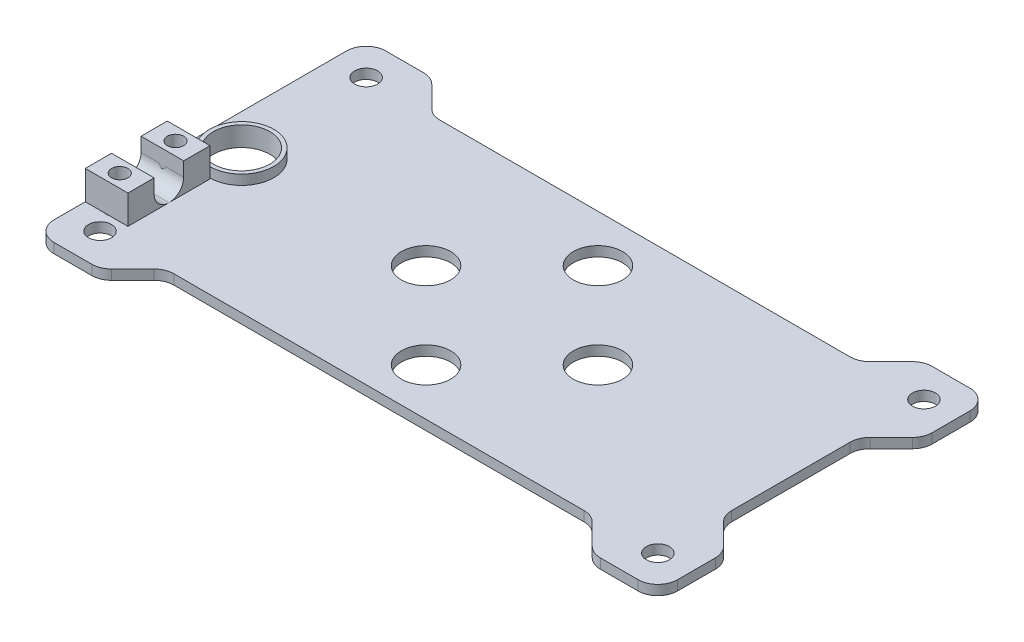
from build123d import *

# Parameters (mm, degrees)
SKETCH1_W           = 95
SKETCH1_H           = 50.55
SKETCH1_R           = 1.75
SKETCH1_R_2         = 3.75
SKETCH1_R_3         = 4.3
BOSS_EXTRUDE1_DEPTH = 1.5
CUT_EXTRUDE1_DEPTH  = 1.5
FILLET1_R           = 3
SKETCH3_R           = 4.9
SKETCH3_R_2         = 4.3
BOSS_EXTRUDE2_DEPTH = 1.5
SKETCH5_W           = 6.5
SKETCH5_H           = 4
BOSS_EXTRUDE3_DEPTH = 4.4
CUT_EXTRUDE2_REACH  = 56.128
SKETCH6_R           = 1.25
SKETCH8_R           = 2.05
CUT_EXTRUDE3_DEPTH  = 1.5
FILLET2_R           = 2.25


with BuildPart() as part:
    # Sketch1 → Boss-Extrude1 (new body)
    with BuildSketch(Plane(origin=(0, 0, 0), x_dir=(1, 0, 0), z_dir=(0, 1, 0))):
        Rectangle(SKETCH1_W, SKETCH1_H)
        with Locations(Location((-42.5, 20.275, 0), (0, 0, 270))):
            Circle(SKETCH1_R, mode=Mode.SUBTRACT)
        with Locations(Location((42.5, 20.275, 0), (0, 0, 90))):
            Circle(SKETCH1_R, mode=Mode.SUBTRACT)
        with Locations(Location((42.5, -20.275, 0), (0, 0, 270))):
            Circle(SKETCH1_R, mode=Mode.SUBTRACT)
        with Locations(Location((-42.5, -20.275, 0), (0, 0, 90))):
            Circle(SKETCH1_R, mode=Mode.SUBTRACT)
        with Locations(Location((-13.1, 0, 0), (0, 0, 270))):
            Circle(SKETCH1_R_2, mode=Mode.SUBTRACT)
        with Locations(Location((13.1, 0, 0), (0, 0, 90))):
            Circle(SKETCH1_R_2, mode=Mode.SUBTRACT)
        with Locations(Location((0, 13.1, 0), (0, 0, 270))):
            Circle(SKETCH1_R_2, mode=Mode.SUBTRACT)
        with Locations(Location((0, -13.1, 0), (0, 0, 90))):
            Circle(SKETCH1_R_2, mode=Mode.SUBTRACT)
        with Locations(Location((-41.2, 0, 0), (0, 0, 270))):
            Circle(SKETCH1_R_3, mode=Mode.SUBTRACT)
    extrude(amount=BOSS_EXTRUDE1_DEPTH)

    # Sketch2 → Cut-Extrude1 (cut)
    with BuildSketch(Plane(origin=(0, 1.5, 0), x_dir=(1, 0, 0), z_dir=(0, 1, 0))):
        Polygon((-32.5, 20.275), (32.5, 20.275), (37.5, 25.275), (-37.5, 25.275), align=None)
        Polygon((37.5, -25.275), (32.5, -20.275), (-32.5, -20.275), (-37.5, -25.275), align=None)
        Polygon((47.5, -15.275), (47.5, 15.275), (42.5, 10.275), (42.5, -10.275), align=None)
    extrude(amount=-CUT_EXTRUDE1_DEPTH, mode=Mode.SUBTRACT)

    # Fillet1
    fillet1_edges = [part.edges().sort_by_distance(p)[0] for p in [
        (37.5, 0.75, -25.275),
        (32.5, 0.75, -20.275),
        (-32.5, 0.75, -20.275),
        (-37.5, 0.75, -25.275),
        (-37.5, 0.75, 25.275),
        (-32.5, 0.75, 20.275),
        (32.5, 0.75, 20.275),
        (37.5, 0.75, 25.275),
        (47.5, 0.75, 25.275),
        (-47.5, 0.75, 25.275),
        (-47.5, 0.75, -25.275),
        (47.5, 0.75, -25.275),
        (47.5, 0.75, 15.275),
        (42.5, 0.75, 10.275),
        (42.5, 0.75, -10.275),
        (47.5, 0.75, -15.275),
    ]]
    fillet(fillet1_edges, radius=FILLET1_R)

    # Sketch3 → Boss-Extrude2 (add)
    with BuildSketch(Plane(origin=(0, 1.5, 0), x_dir=(1, 0, 0), z_dir=(0, 1, 0))):
        with Locations(Location((-41.2, 0, 0), (0, 0, 270))):
            Circle(SKETCH3_R)
        with Locations(Location((-41.2, 0, 0), (0, 0, 270))):
            Circle(SKETCH3_R_2, mode=Mode.SUBTRACT)
    extrude(amount=BOSS_EXTRUDE2_DEPTH)

    # Sketch5 → Boss-Extrude3 (add)
    with BuildSketch(Plane(origin=(0, 1.5, 0), x_dir=(1, 0, 0), z_dir=(0, 1, 0))):
        with Locations((-44.25, -7.025)):
            Rectangle(SKETCH5_W, SKETCH5_H)
        with Locations((-44.25, -15.525)):
            Rectangle(SKETCH5_W, SKETCH5_H)
    extrude(amount=BOSS_EXTRUDE3_DEPTH)

    # Sketch6 → Cut-Extrude2 (cut, up to next)
    with BuildSketch(Plane(origin=(0, 5.9, 0), x_dir=(1, 0, 0), z_dir=(0, 1, 0)), mode=Mode.PRIVATE) as cut_extrude2_sk1:
        with Locations(Location((-44.25, -7.025, 0), (0, 0, 270))):
            Circle(SKETCH6_R)
    cut_extrude2_tool1 = extrude(cut_extrude2_sk1.sketch, amount=-CUT_EXTRUDE2_REACH, mode=Mode.PRIVATE) & part.part
    # Sketch6 → Cut-Extrude2 (cut, up to next)
    with BuildSketch(Plane(origin=(0, 5.9, 0), x_dir=(1, 0, 0), z_dir=(0, 1, 0)), mode=Mode.PRIVATE) as cut_extrude2_sk2:
        with Locations(Location((-44.25, -15.525, 0), (0, 0, 270))):
            Circle(SKETCH6_R)
    cut_extrude2_tool2 = extrude(cut_extrude2_sk2.sketch, amount=-CUT_EXTRUDE2_REACH, mode=Mode.PRIVATE) & part.part
    add(cut_extrude2_tool1.solids().sort_by_distance((-44.25, 5.9, 7.025))[0], mode=Mode.SUBTRACT)
    add(cut_extrude2_tool2.solids().sort_by_distance((-44.25, 5.9, 15.525))[0], mode=Mode.SUBTRACT)

    # Sketch8 → Cut-Extrude3 (cut)
    with BuildSketch(Plane.XZ):
        with Locations(Location((-44.25, 15.525, 0), (0, 0, 270))):
            Circle(SKETCH8_R)
        with Locations(Location((-44.25, 7.025, 0), (0, 0, 270))):
            Circle(SKETCH8_R)
    extrude(amount=-CUT_EXTRUDE3_DEPTH, mode=Mode.SUBTRACT)

    # Fillet2
    # the kernel refuses this fillet: 2.25 mm, written as the material it adds along each edge
    with BuildSketch(Plane(origin=(-39.075, 1.5, 13.525), x_dir=(0, 0, -1), z_dir=(-1, 0, 0))) as fillet2_piece_1_section:
        with BuildLine():
            CenterArc((FILLET2_R, -FILLET2_R), FILLET2_R, 90, 90)
            Line((0, -FILLET2_R), (0, 0))
            Line((0, 0), (FILLET2_R, 0))
        make_face()
    fillet2_piece_1 = extrude(amount=8.425, mode=Mode.PRIVATE)
    fillet2_piece_1 = fillet2_piece_1 - Plane(origin=(-44.25, 1.998463369, 15.525), x_dir=(0, 0, -1), z_dir=(0, -1, 0)) * Cylinder(2.05, 26, mode=Mode.PRIVATE)
    fillet2_piece_1 = split(fillet2_piece_1, bisect_by=Plane(origin=(-41, 1.998463369, 13.018330937), z_dir=(-1, 0, 0)), keep=Keep.TOP, mode=Mode.PRIVATE)
    add(fillet2_piece_1)
    with BuildSketch(Plane(origin=(-41, 1.5, 13.525), x_dir=(0, 0, -1), z_dir=(-1, 0, 0))) as fillet2_piece_2_section:
        with BuildLine():
            CenterArc((FILLET2_R, -FILLET2_R), FILLET2_R, 90, 90)
            Line((0, -FILLET2_R), (0, 0))
            Line((0, 0), (FILLET2_R, 0))
        make_face()
    fillet2_piece_2 = extrude(amount=8.425, mode=Mode.PRIVATE)
    fillet2_piece_2 = split(fillet2_piece_2, bisect_by=Plane(origin=(-47.5, 1.998463369, 13.018330937), z_dir=(1, 0, 0)), keep=Keep.TOP, mode=Mode.PRIVATE)
    fillet2_piece_2 = fillet2_piece_2 - Plane(origin=(-44.25, 1.998463369, 15.525), x_dir=(0, 0, -1), z_dir=(0, -1, 0)) * Cylinder(2.05, 26, mode=Mode.PRIVATE)
    add(fillet2_piece_2)
    with BuildSketch(Plane(origin=(-47.5, 1.5, 9.025), x_dir=(0, 0, 1), z_dir=(1, 0, 0))) as fillet2_piece_3_section:
        with BuildLine():
            CenterArc((FILLET2_R, -FILLET2_R), FILLET2_R, 90, 90)
            Line((0, -FILLET2_R), (0, 0))
            Line((0, 0), (FILLET2_R, 0))
        make_face()
    fillet2_piece_3 = extrude(amount=8.425, mode=Mode.PRIVATE)
    fillet2_piece_3 = fillet2_piece_3 - Plane(origin=(-44.25, 1.998463384, 7.025), x_dir=(0, 0, -1), z_dir=(0, -1, 0)) * Cylinder(2.05, 26, mode=Mode.PRIVATE)
    fillet2_piece_3 = split(fillet2_piece_3, bisect_by=Plane(origin=(-41, 1.998463384, 9.531669097), z_dir=(-1, 0, 0)), keep=Keep.TOP, mode=Mode.PRIVATE)
    add(fillet2_piece_3)
    with BuildSketch(Plane(origin=(-49.425, 1.5, 9.025), x_dir=(0, 0, 1), z_dir=(1, 0, 0))) as fillet2_piece_4_section:
        with BuildLine():
            CenterArc((FILLET2_R, -FILLET2_R), FILLET2_R, 90, 90)
            Line((0, -FILLET2_R), (0, 0))
            Line((0, 0), (FILLET2_R, 0))
        make_face()
    fillet2_piece_4 = extrude(amount=8.425, mode=Mode.PRIVATE)
    fillet2_piece_4 = split(fillet2_piece_4, bisect_by=Plane(origin=(-47.5, 1.998463384, 9.531669097), z_dir=(1, 0, 0)), keep=Keep.TOP, mode=Mode.PRIVATE)
    fillet2_piece_4 = fillet2_piece_4 - Plane(origin=(-44.25, 1.998463384, 7.025), x_dir=(0, 0, -1), z_dir=(0, -1, 0)) * Cylinder(2.05, 26, mode=Mode.PRIVATE)
    add(fillet2_piece_4)


solid = part.part
